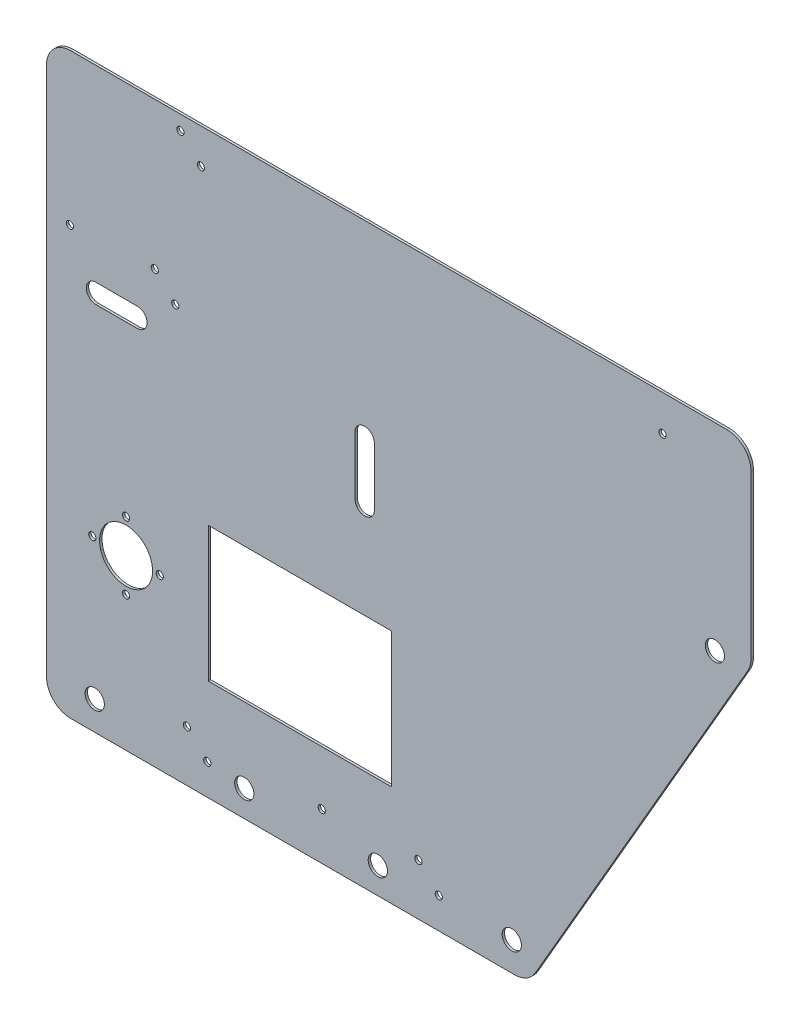
from build123d import *

# Parameters (mm, degrees)
BOSS_EXTRUDE1_DEPTH = 1
SKETCH2_R           = 4
SKETCH2_R_2         = 11
SKETCH2_R_3         = 1.5
SKETCH2_W           = 76
SKETCH2_H           = 56
CUT_EXTRUDE1_DEPTH  = 3
SKETCH3_W           = 292.37604307
SKETCH3_H           = 50
BOSS_EXTRUDE2_DEPTH = 1
FILLET1_R           = 10
SKETCH4_R           = 1.5
CUT_EXTRUDE2_DEPTH  = 11


with BuildPart() as part:
    # Sketch1 → Boss-Extrude1 (new body)
    with BuildSketch(Plane.XY):
        Polygon((-100, 110), (-100, -80), (100, -80), (192.37604307, 80), (192.37604307, 110), align=None)
    extrude(amount=BOSS_EXTRUDE1_DEPTH)

    # Sketch2 → Cut-Extrude1 (cut)
    with BuildSketch(Plane.XY.offset(1)):
        with Locations((93.07179677, -68)):
            Circle(SKETCH2_R)
        with Locations((177.364936071, 78)):
            Circle(SKETCH2_R)
        with Locations((-67, -10)):
            Circle(SKETCH2_R_2)
        with Locations((-80, -68)):
            Circle(SKETCH2_R)
        with Locations((-53, -10)):
            Circle(SKETCH2_R_3)
        with Locations((-67, 4)):
            Circle(SKETCH2_R_3)
        with Locations((-81, -10)):
            Circle(SKETCH2_R_3)
        with Locations((-67, -24)):
            Circle(SKETCH2_R_3)
        with Locations((62.79605759, -67.242640687)):
            Circle(SKETCH2_R_3)
        with Locations((54.310776216, -58.757359313)):
            Circle(SKETCH2_R_3)
        with Locations((-33.274226936, -67.242640687)):
            Circle(SKETCH2_R_3)
        with Locations((-41.75950831, -58.757359313)):
            Circle(SKETCH2_R_3)
        with Locations((14.225855729, -60.5)):
            Circle(SKETCH2_R_3)
        with Locations((-46.588971723, 90.47428948)):
            Circle(SKETCH2_R_3)
        with Locations((-55.074253097, 98.959570854)):
            Circle(SKETCH2_R_3)
        with Locations((-90.295627115, 97.216930167)):
            Circle(SKETCH2_R_3)
        with Locations((155.651799279, 145.145615666)):
            Circle(SKETCH2_R_3)
        with Locations((-17.947932492, -69.117445741)):
            Circle(SKETCH2_R)
        with Locations((37.494421294, -69.117445741)):
            Circle(SKETCH2_R)
        with BuildLine():
            Line((-79.516586773, 82), (-62.300333374, 82))
            ThreePointArc((-62.300333374, 82), (-58.300333374, 78), (-62.300333374, 74))
            Line((-62.300333374, 74), (-79.516586773, 74))
            ThreePointArc((-79.516586773, 74), (-83.516586773, 78), (-79.516586773, 82))
        make_face()
        with Locations((5.141640745, -10)):
            Rectangle(SKETCH2_W, SKETCH2_H)
        with BuildLine():
            Line((36.026164778, 82), (36.026164778, 57.777585682))
            ThreePointArc((36.026164778, 57.777585682), (32.026164778, 53.777585682), (28.026164778, 57.777585682))
            Line((28.026164778, 57.777585682), (28.026164778, 82))
            ThreePointArc((28.026164778, 82), (32.026164778, 86), (36.026164778, 82))
        make_face()
    extrude(amount=-CUT_EXTRUDE1_DEPTH, mode=Mode.SUBTRACT)

    # Sketch3 → Boss-Extrude2 (add)
    with BuildSketch(Plane.XY.offset(1)):
        with Locations((46.188021535, 135)):
            Rectangle(SKETCH3_W, SKETCH3_H)
    extrude(amount=-BOSS_EXTRUDE2_DEPTH)

    # Fillet1
    fillet1_edges = [part.edges().sort_by_distance(p)[0] for p in [
        (100, -80, 0.5),
        (-100, -80, 0.5),
        (-100, 160, 0.5),
        (192.37604307, 160, 0.5),
        (192.37604307, 80, 0.5),
    ]]
    fillet(fillet1_edges, radius=FILLET1_R)

    # Sketch4 → Cut-Extrude2 (cut)
    with BuildSketch(Plane.XY.offset(1)):
        with Locations((-44.442274409, 153.959570854)):
            Circle(SKETCH4_R)
        with Locations((-35.956993035, 145.47428948)):
            Circle(SKETCH4_R)
        with Locations((155.651799279, 145.145615666)):
            Circle(SKETCH4_R)
    extrude(amount=-CUT_EXTRUDE2_DEPTH, mode=Mode.SUBTRACT)


solid = part.part
